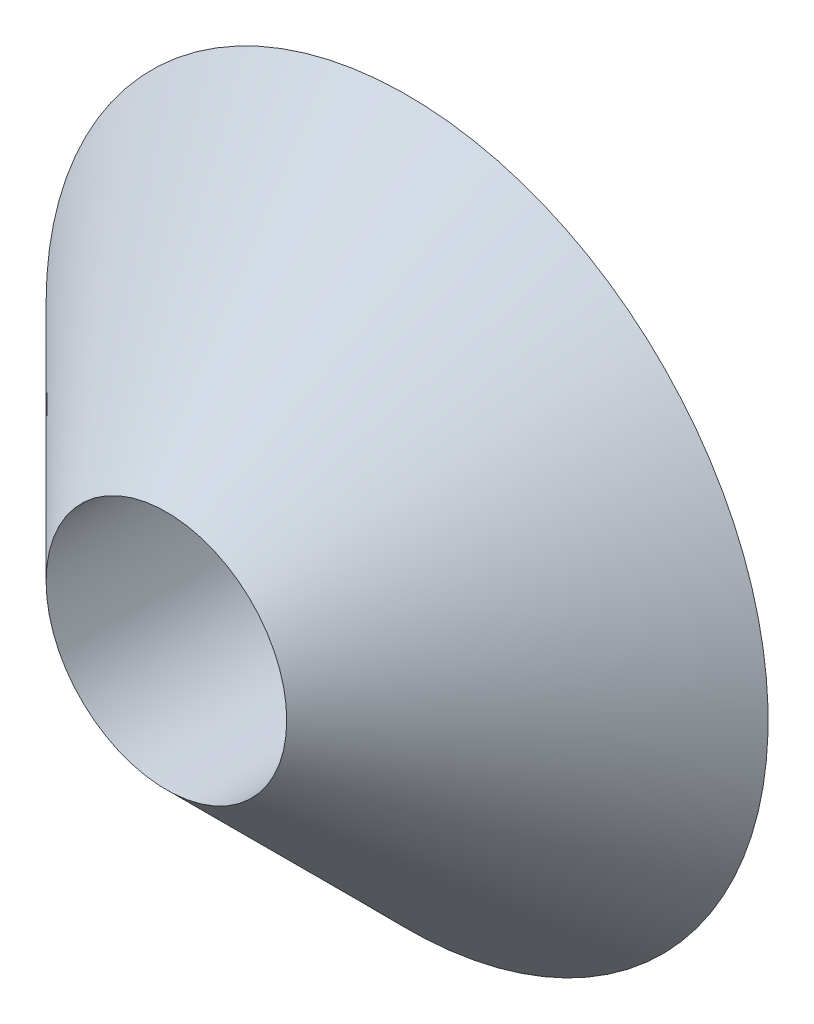
from build123d import *

# Parameters (mm, degrees)
SKETCH14_R         = 5
CUT_EXTRUDE1_DEPTH = 24.452078799


with BuildPart() as part:
    # Sketch1 → Revolve1 (revolve)
    with BuildSketch(Plane(origin=(0, 0, 0), x_dir=(1, 0, 0), z_dir=(0, 1, 0))):
        Polygon((0, 0), (-5, 0), (-15, 10), (0, 10), align=None)
    revolve(axis=Axis((0, 0, 0), (0, 0, -1)))

    # Sketch14 → Cut-Extrude1 (cut, through all)
    with BuildSketch(Plane.XY):
        Circle(SKETCH14_R)
    extrude(amount=-CUT_EXTRUDE1_DEPTH, mode=Mode.SUBTRACT)


solid = part.part
